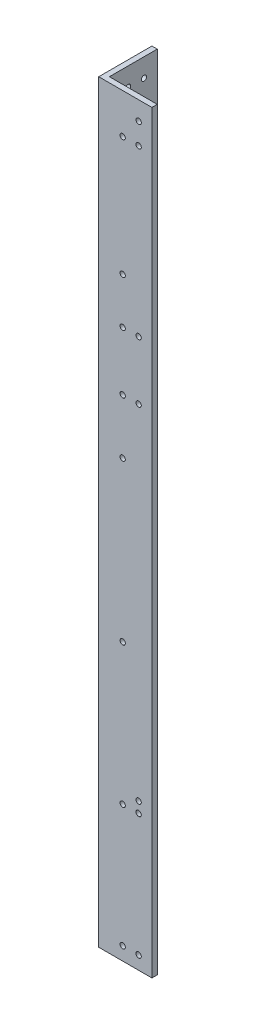
from build123d import *

# Parameters (mm, degrees)
BOSS_EXTRUDE1_DEPTH               = 450
RIGHTSIDEHOLES_SKETCH3_R          = 1.5875
RIGHTSIDEHOLES_CUT_EXTRUDE1_DEPTH = 3.175
FRONTSIDEHOLES_SKETCH4_R          = 1.5875
FRONTSIDEHOLES_SKETCH4_R_2        = 2
FRONTSIDEHOLES_CUT_EXTRUDE2_DEPTH = 3.175


with BuildPart() as part:
    # Sketch2 → Boss-Extrude1 (new body)
    with BuildSketch(Plane(origin=(0, 0, 0), x_dir=(1, 0, 0), z_dir=(0, 1, 0))):
        Polygon((0, 31.75), (3.175, 31.75), (3.175, 3.175), (31.75, 3.175), (31.75, 0), (0, 0), align=None)
    extrude(amount=BOSS_EXTRUDE1_DEPTH)

    # RightSideHoles-Sketch3 → RightSideHoles-Cut-Extrude1 (cut)
    with BuildSketch(Plane.XY):
        with Locations((14.2875, 81.1125)):
            Circle(RIGHTSIDEHOLES_SKETCH3_R)
        with Locations((23.8125, 81.1125)):
            Circle(RIGHTSIDEHOLES_SKETCH3_R)
        with Locations((23.8125, 87.4625)):
            Circle(RIGHTSIDEHOLES_SKETCH3_R)
        with Locations((14.2875, 426.1875)):
            Circle(RIGHTSIDEHOLES_SKETCH3_R)
        with Locations((23.8125, 438.8875)):
            Circle(RIGHTSIDEHOLES_SKETCH3_R)
        with Locations((23.8125, 426.1875)):
            Circle(RIGHTSIDEHOLES_SKETCH3_R)
        with Locations((14.2875, 327.602644)):
            Circle(RIGHTSIDEHOLES_SKETCH3_R)
        with Locations((23.8125, 327.602644)):
            Circle(RIGHTSIDEHOLES_SKETCH3_R)
        with Locations((14.2875, 292.677644)):
            Circle(RIGHTSIDEHOLES_SKETCH3_R)
        with Locations((23.8125, 292.677644)):
            Circle(RIGHTSIDEHOLES_SKETCH3_R)
        with Locations((14.2875, 7.9375)):
            Circle(RIGHTSIDEHOLES_SKETCH3_R)
        with Locations((23.8125, 7.9375)):
            Circle(RIGHTSIDEHOLES_SKETCH3_R)
        with Locations((14.2875, 165)):
            Circle(RIGHTSIDEHOLES_SKETCH3_R)
        with Locations((14.2875, 260)):
            Circle(RIGHTSIDEHOLES_SKETCH3_R)
        with Locations((14.2875, 355)):
            Circle(RIGHTSIDEHOLES_SKETCH3_R)
    extrude(amount=-RIGHTSIDEHOLES_CUT_EXTRUDE1_DEPTH, mode=Mode.SUBTRACT)

    # FrontSideHoles-Sketch4 → FrontSideHoles-Cut-Extrude2 (cut)
    with BuildSketch(Plane.ZY):
        with Locations((-23.8125, 81.1125)):
            Circle(FRONTSIDEHOLES_SKETCH4_R)
        with Locations((-23.8125, 87.4625)):
            Circle(FRONTSIDEHOLES_SKETCH4_R)
        with Locations((-14.2875, 87.4625)):
            Circle(FRONTSIDEHOLES_SKETCH4_R)
        with Locations((-23.8125, 438.8875)):
            Circle(FRONTSIDEHOLES_SKETCH4_R)
        with Locations((-14.2875, 438.8875)):
            Circle(FRONTSIDEHOLES_SKETCH4_R)
        with Locations((-23.8125, 426.1875)):
            Circle(FRONTSIDEHOLES_SKETCH4_R)
        with Locations((-14.2875, 333.177644)):
            Circle(FRONTSIDEHOLES_SKETCH4_R_2)
        with Locations((-14.2875, 314.652644)):
            Circle(FRONTSIDEHOLES_SKETCH4_R_2)
        with Locations((-14.2875, 165)):
            Circle(FRONTSIDEHOLES_SKETCH4_R)
        with Locations((-14.2875, 260)):
            Circle(FRONTSIDEHOLES_SKETCH4_R)
        with Locations((-14.2875, 355)):
            Circle(FRONTSIDEHOLES_SKETCH4_R)
        with Locations((-23.8125, 7.9375)):
            Circle(FRONTSIDEHOLES_SKETCH4_R)
        with Locations((-14.2875, 7.9375)):
            Circle(FRONTSIDEHOLES_SKETCH4_R)
    extrude(amount=-FRONTSIDEHOLES_CUT_EXTRUDE2_DEPTH, mode=Mode.SUBTRACT)


solid = part.part
